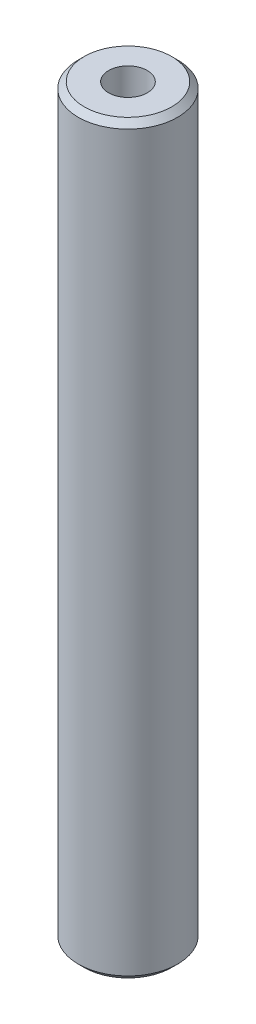
from build123d import *

# Parameters (mm, degrees)
SKETCH1_R           = 40
BOSS_EXTRUDE1_DEPTH = 600
SKETCH2_R           = 15.574783188
CUT_EXTRUDE1_DEPTH  = 603.660766933
CHAMFER1_SIZE       = 4.831119613


with BuildPart() as part:
    # Sketch1 → Boss-Extrude1 (new body)
    with BuildSketch(Plane(origin=(0, 0, 0), x_dir=(1, 0, 0), z_dir=(0, 1, 0))):
        Circle(SKETCH1_R)
    extrude(amount=BOSS_EXTRUDE1_DEPTH)

    # Sketch2 → Cut-Extrude1 (cut, through all)
    with BuildSketch(Plane(origin=(0, 0, 0), x_dir=(1, 0, 0), z_dir=(0, 1, 0))):
        Circle(SKETCH2_R)
    extrude(amount=CUT_EXTRUDE1_DEPTH, mode=Mode.SUBTRACT)

    # Chamfer1
    chamfer1_edges = [part.edges().sort_by_distance(p)[0] for p in [
        (-40, 600, 0),
        (-40, 0, 0),
    ]]
    chamfer(chamfer1_edges, length=CHAMFER1_SIZE)


solid = part.part
